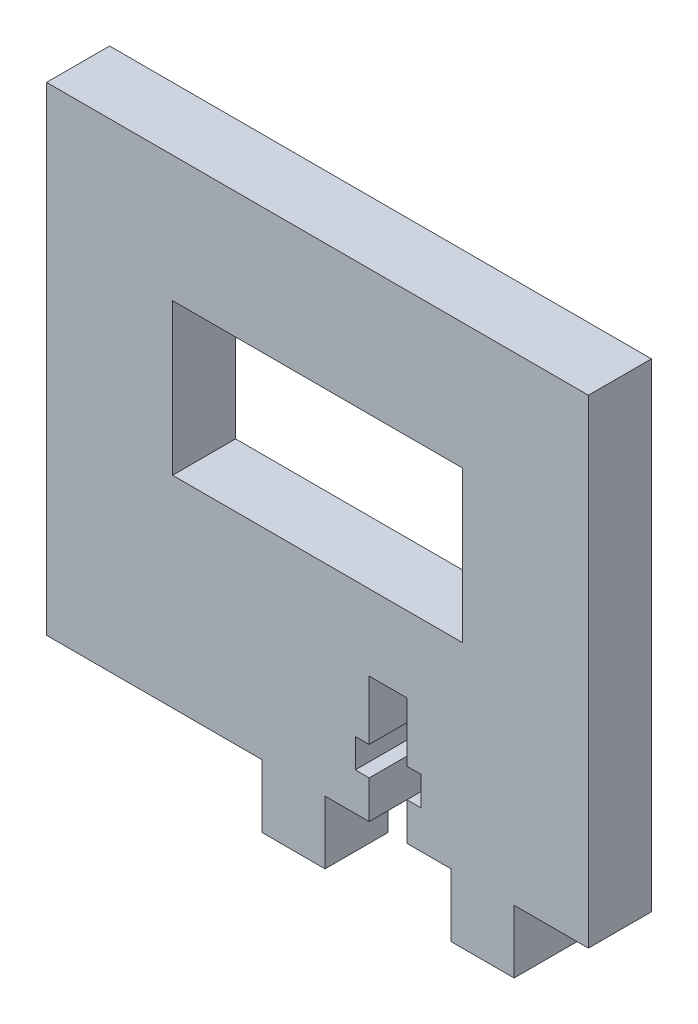
from build123d import *

# Parameters (mm, degrees)
SKETCH1_W           = 23
SKETCH1_H           = 12
BOSS_EXTRUDE3_DEPTH = 5


with BuildPart() as part:
    # Sketch1 → Boss-Extrude3 (new body)
    with BuildSketch(Plane.XY):
        Polygon((-27.1, 16), (-27.1, -22), (-10, -22), (-10, -27), (-5, -27), (-5, -22), (-1.5, -22), (-1.5, -19), (-2.6, -19), (-2.6, -16.7), (-1.5, -16.7), (-1.5, -12), (1.5, -12), (1.5, -16.7), (2.6, -16.7), (2.6, -19), (1.5, -19), (1.5, -22), (5, -22), (5, -27), (10, -27), (10, -22), (15.9, -22), (15.9, 16), align=None)
        with Locations((-5.6, 0)):
            Rectangle(SKETCH1_W, SKETCH1_H, mode=Mode.SUBTRACT)
    extrude(amount=BOSS_EXTRUDE3_DEPTH)


solid = part.part
